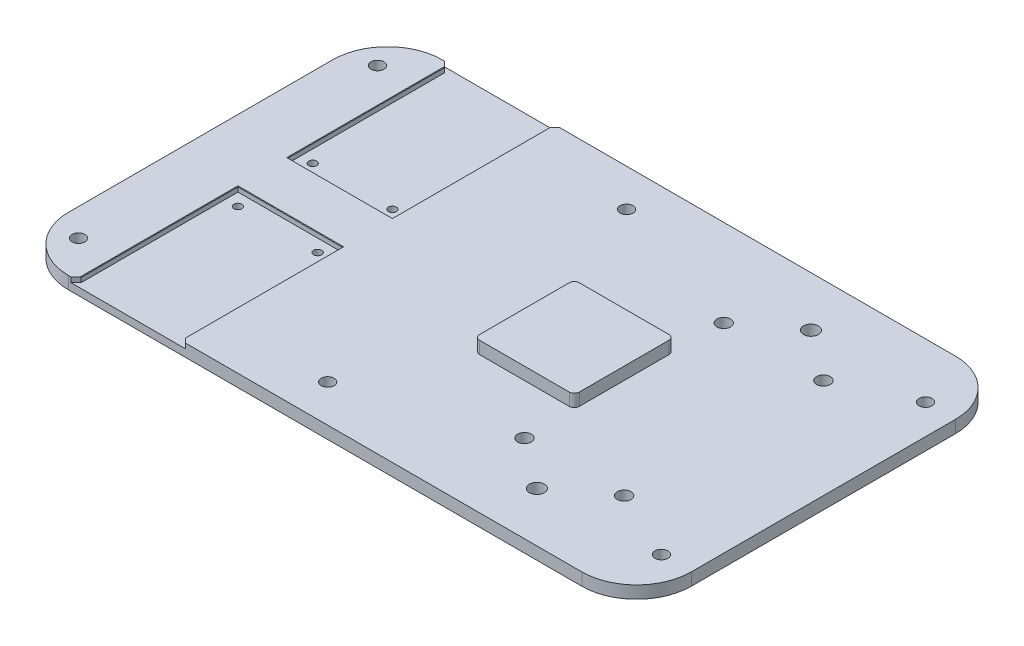
from build123d import *

# Parameters (mm, degrees)
SKETCH_1_R          = 2.6
SKETCH_1_R_2        = 3
SKETCH_1_R_3        = 2.75
EXTRUDE_1_DEPTH     = 5
SKETCH_2_W          = 42
SKETCH_2_H          = 65
CUT_EXTRUDE_1_DEPTH = 2
CHAMFER_1_SIZE      = 0.2
SKETCH_3_R          = 1.6
CUT_EXTRUDE_2_DEPTH = 3
CHAMFER_2_SIZE      = 2
SKETCH_4_W          = 40
SKETCH_4_H          = 40
EXTRUDE_2_DEPTH     = 5
FILLET_3_R          = 2


with BuildPart() as part:
    # 草图1 → 凸台-拉伸1 (new body)
    with BuildSketch(Plane(origin=(0, 0, 0), x_dir=(1, 0, 0), z_dir=(0, 1, 0))):
        with BuildLine():
            Line((103, 75), (95, 75))
            Line((95, 75), (55, 75))
            Line((55, 75), (-103, 75))
            ThreePointArc((-103, 75), (-118.556349186, 68.556349186), (-125, 53))
            Line((-125, 53), (-125, -53))
            ThreePointArc((-125, -53), (-118.556349186, -68.556349186), (-103, -75))
            Line((-103, -75), (55, -75))
            Line((55, -75), (95, -75))
            Line((95, -75), (103, -75))
            ThreePointArc((103, -75), (118.556349186, -68.556349186), (125, -53))
            Line((125, -53), (125, 53))
            ThreePointArc((125, 53), (118.556349186, 68.556349186), (103, 75))
        make_face()
        with Locations((-114, 60)):
            Circle(SKETCH_1_R, mode=Mode.SUBTRACT)
        with Locations((-14, 60)):
            Circle(SKETCH_1_R, mode=Mode.SUBTRACT)
        with Locations((113, 53)):
            Circle(SKETCH_1_R, mode=Mode.SUBTRACT)
        with Locations((-114, -60)):
            Circle(SKETCH_1_R, mode=Mode.SUBTRACT)
        with Locations((-14, -60)):
            Circle(SKETCH_1_R, mode=Mode.SUBTRACT)
        with Locations((113, -53)):
            Circle(SKETCH_1_R, mode=Mode.SUBTRACT)
        with Locations((65, -55)):
            Circle(SKETCH_1_R_2, mode=Mode.SUBTRACT)
        with Locations((65, 55)):
            Circle(SKETCH_1_R_2, mode=Mode.SUBTRACT)
        with Locations((45, -40)):
            Circle(SKETCH_1_R_3, mode=Mode.SUBTRACT)
        with Locations((85, -40)):
            Circle(SKETCH_1_R_3, mode=Mode.SUBTRACT)
        with Locations((85, 40)):
            Circle(SKETCH_1_R_3, mode=Mode.SUBTRACT)
        with Locations((45, 40)):
            Circle(SKETCH_1_R_3, mode=Mode.SUBTRACT)
    extrude(amount=EXTRUDE_1_DEPTH)

    # 草图2 → 切除-拉伸1 (cut)
    with BuildSketch(Plane(origin=(0, 5, 0), x_dir=(1, 0, 0), z_dir=(0, 1, 0))):
        with Locations((-79, -42.5)):
            Rectangle(SKETCH_2_W, SKETCH_2_H)
        with Locations((-79, 42.5)):
            Rectangle(SKETCH_2_W, SKETCH_2_H)
    extrude(amount=-CUT_EXTRUDE_1_DEPTH, mode=Mode.SUBTRACT)

    # 倒角1
    chamfer_1_edges = [part.edges().sort_by_distance(p)[0] for p in [
        (-58, 5, -42.5),
        (-79, 5, -10),
        (-100, 5, -42.5),
        (-58, 5, 42.5),
        (-79, 5, 10),
        (-100, 5, 42.5),
    ]]
    chamfer(chamfer_1_edges, length=CHAMFER_1_SIZE)

    # 草图3 → 切除-拉伸2 (cut)
    with BuildSketch(Plane(origin=(0, 3, 0), x_dir=(1, 0, 0), z_dir=(0, 1, 0))):
        with Locations((-95, 15)):
            Circle(SKETCH_3_R)
        with Locations((-63, 15)):
            Circle(SKETCH_3_R)
        with Locations((-63, -15)):
            Circle(SKETCH_3_R)
        with Locations((-95, -15)):
            Circle(SKETCH_3_R)
    extrude(amount=-CUT_EXTRUDE_2_DEPTH, mode=Mode.SUBTRACT)

    # 倒角2
    chamfer_2_edges = [part.edges().sort_by_distance(p)[0] for p in [
        (-100, 3.9, -75),
        (-58, 3.9, -75),
        (-58, 3.9, 75),
        (-100, 3.9, 75),
    ]]
    chamfer(chamfer_2_edges, length=CHAMFER_2_SIZE)

    # 草图4 → 凸台-拉伸2 (add)
    with BuildSketch(Plane(origin=(0, 5, 0), x_dir=(1, 0, 0), z_dir=(0, 1, 0))):
        with Locations((25, 0)):
            Rectangle(SKETCH_4_W, SKETCH_4_H)
    extrude(amount=EXTRUDE_2_DEPTH)

    # 圆角3
    fillet_3_edges = [part.edges().sort_by_distance(p)[0] for p in [
        (5, 7.5, -20),
        (45, 7.5, -20),
        (45, 7.5, 20),
        (5, 7.5, 20),
    ]]
    fillet(fillet_3_edges, radius=FILLET_3_R)


solid = part.part
